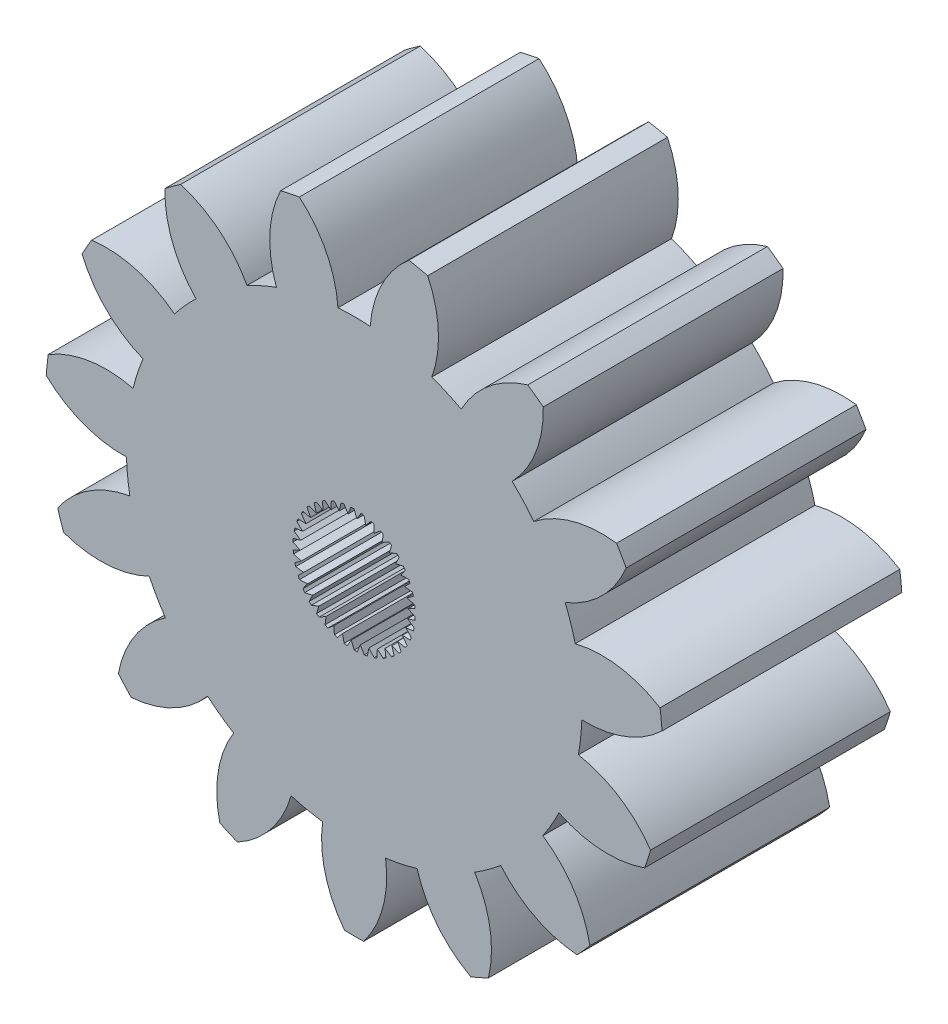
from build123d import *

# Parameters (mm, degrees)
SKETCH1_R           = 70.548036847
BOSS_EXTRUDE1_DEPTH = 10
SKETCH3_R           = 367.512428381
SKETCH3_R_2         = 2.25
CUT_EXTRUDE2_DEPTH  = 269.283414963
CUT_EXTRUDE4_DEPTH  = 10


with BuildPart() as part:
    # Sketch1 → Boss-Extrude1 (new body)
    with BuildSketch(Plane.XY):
        Circle(SKETCH1_R)
    extrude(amount=BOSS_EXTRUDE1_DEPTH)

    # Sketch3 → Cut-Extrude2 (cut, through all)
    # profile 1 of 2: a face of its own
    with BuildSketch(Plane(origin=(55.025604462, -141.718387499, 105.594585314), x_dir=(1, 0, 0), z_dir=(0, 0, 1))):
        with Locations((-43.46157653, 148.105383059)):
            Circle(SKETCH3_R)
        with BuildLine():
            ThreePointArc((-38.992966759, 156.489924055), (-37.83485513, 157.900828095), (-36.221197709, 158.75404699))
            ThreePointArc((-36.221197709, 158.75404699), (-35.892665836, 158.523094895), (-35.57149541, 158.282010639))
            ThreePointArc((-35.57149541, 158.282010639), (-35.884307233, 156.483672095), (-36.86828054, 154.946249158))
            ThreePointArc((-36.86828054, 154.946249158), (-36.400957543, 154.46279295), (-35.968998313, 153.947495063))
            ThreePointArc((-35.968998313, 153.947495063), (-34.337144322, 154.765373604), (-32.515959526, 154.888494247))
            ThreePointArc((-32.515959526, 154.888494247), (-32.309767406, 154.543883059), (-32.114421422, 154.193009851))
            ThreePointArc((-32.114421422, 154.193009851), (-33.131639425, 152.677377874), (-34.655870014, 151.673090132))
            ThreePointArc((-34.655870014, 151.673090132), (-34.425588569, 151.041353522), (-34.240564709, 150.394911831))
            ThreePointArc((-34.240564709, 150.394911831), (-32.417130736, 150.478346243), (-30.70331796, 149.850079957))
            ThreePointArc((-30.70331796, 149.850079957), (-30.655118083, 149.45139608), (-30.619373638, 149.051403085))
            ThreePointArc((-30.619373638, 149.051403085), (-32.165111587, 148.080544213), (-33.966046143, 147.783042142))
            ThreePointArc((-33.966046143, 147.783042142), (-34.012624002, 147.112258129), (-34.106527819, 146.446448275))
            ThreePointArc((-34.106527819, 146.446448275), (-32.406802163, 145.78101199), (-31.096695207, 144.509991723))
            ThreePointArc((-31.096695207, 144.509991723), (-31.21482177, 144.126171222), (-31.344859402, 143.746220863))
            ThreePointArc((-31.344859402, 143.746220863), (-33.151845163, 143.488005415), (-34.918085739, 143.948729824))
            ThreePointArc((-34.918085739, 143.948729824), (-35.233469169, 143.354883059), (-35.590063839, 142.784829614))
            ThreePointArc((-35.590063839, 142.784829614), (-34.307944508, 141.485582611), (-33.628072766, 139.791579314))
            ThreePointArc((-33.628072766, 139.791579314), (-33.892100612, 139.488988241), (-34.165435635, 139.194777386))
            ThreePointArc((-34.165435635, 139.194777386), (-35.921224953, 139.693853158), (-37.347372509, 140.833140613))
            ThreePointArc((-37.347372509, 140.833140613), (-37.877028848, 140.418912595), (-38.434655914, 140.04318298))
            ThreePointArc((-38.434655914, 140.04318298), (-37.791832987, 138.334776868), (-37.85975246, 136.510699101))
            ThreePointArc((-37.85975246, 136.510699101), (-38.224028777, 136.341658201), (-38.59339908, 136.18405858))
            ThreePointArc((-38.59339908, 136.18405858), (-39.994400032, 137.354130838), (-40.833860699, 138.974988187))
            ThreePointArc((-40.833860699, 138.974988187), (-41.486207556, 138.812002704), (-42.148448231, 138.695563981))
            ThreePointArc((-42.148448231, 138.695563981), (-42.256071633, 136.873397699), (-43.060038427, 135.234645079))
            ThreePointArc((-43.060038427, 135.234645079), (-43.46157653, 135.228383059), (-43.863114633, 135.234645079))
            ThreePointArc((-43.863114633, 135.234645079), (-44.667081427, 136.873397699), (-44.774704829, 138.695563981))
            ThreePointArc((-44.774704829, 138.695563981), (-45.436945504, 138.812002704), (-46.089292361, 138.974988187))
            ThreePointArc((-46.089292361, 138.974988187), (-46.928753028, 137.354130838), (-48.32975398, 136.18405858))
            ThreePointArc((-48.32975398, 136.18405858), (-48.699124283, 136.341658201), (-49.0634006, 136.510699101))
            ThreePointArc((-49.0634006, 136.510699101), (-49.131320073, 138.334776868), (-48.488497146, 140.04318298))
            ThreePointArc((-48.488497146, 140.04318298), (-49.046124212, 140.418912595), (-49.575780551, 140.833140613))
            ThreePointArc((-49.575780551, 140.833140613), (-51.001928107, 139.693853158), (-52.757717425, 139.194777386))
            ThreePointArc((-52.757717425, 139.194777386), (-53.031052448, 139.488988241), (-53.295080295, 139.791579314))
            ThreePointArc((-53.295080295, 139.791579314), (-52.615208552, 141.485582611), (-51.333089221, 142.784829614))
            ThreePointArc((-51.333089221, 142.784829614), (-51.689683891, 143.354883059), (-52.005067321, 143.948729824))
            ThreePointArc((-52.005067321, 143.948729824), (-53.771307897, 143.488005415), (-55.578293658, 143.746220863))
            ThreePointArc((-55.578293658, 143.746220863), (-55.70833129, 144.126171222), (-55.826457853, 144.509991723))
            ThreePointArc((-55.826457853, 144.509991723), (-54.516350897, 145.78101199), (-52.816625241, 146.446448275))
            ThreePointArc((-52.816625241, 146.446448275), (-52.910529058, 147.112258129), (-52.957106917, 147.783042142))
            ThreePointArc((-52.957106917, 147.783042142), (-54.758041473, 148.080544213), (-56.303779422, 149.051403085))
            ThreePointArc((-56.303779422, 149.051403085), (-56.268034977, 149.45139608), (-56.2198351, 149.850079957))
            ThreePointArc((-56.2198351, 149.850079957), (-54.506022324, 150.478346243), (-52.682588351, 150.394911831))
            ThreePointArc((-52.682588351, 150.394911831), (-52.497564491, 151.041353522), (-52.267283046, 151.673090132))
            ThreePointArc((-52.267283046, 151.673090132), (-53.791513635, 152.677377874), (-54.808731638, 154.193009851))
            ThreePointArc((-54.808731638, 154.193009851), (-54.613385655, 154.543883059), (-54.407193535, 154.888494247))
            ThreePointArc((-54.407193535, 154.888494247), (-52.586008738, 154.765373604), (-50.954154747, 153.947495063))
            ThreePointArc((-50.954154747, 153.947495063), (-50.522195517, 154.46279295), (-50.05487252, 154.946249158))
            ThreePointArc((-50.05487252, 154.946249158), (-51.038845827, 156.483672095), (-51.35165765, 158.282010639))
            ThreePointArc((-51.35165765, 158.282010639), (-51.030487224, 158.523094895), (-50.701955351, 158.75404699))
            ThreePointArc((-50.701955351, 158.75404699), (-49.08829793, 157.900828095), (-47.930186301, 156.489924055))
            ThreePointArc((-47.930186301, 156.489924055), (-47.325981376, 156.784978452), (-46.70242122, 157.036560288))
            ThreePointArc((-46.70242122, 157.036560288), (-46.97599932, 158.841284028), (-46.530316958, 160.611380068))
            ThreePointArc((-46.530316958, 160.611380068), (-46.138855373, 160.700989713), (-45.744789893, 160.778349))
            ThreePointArc((-45.744789893, 160.778349), (-44.617675875, 159.342561151), (-44.13355463, 157.582589738))
            ThreePointArc((-44.13355463, 157.582589738), (-43.46157653, 157.606383059), (-42.78959843, 157.582589738))
            ThreePointArc((-42.78959843, 157.582589738), (-42.305477185, 159.342561151), (-41.178363167, 160.778349))
            ThreePointArc((-41.178363167, 160.778349), (-40.784297687, 160.700989713), (-40.392836102, 160.611380068))
            ThreePointArc((-40.392836102, 160.611380068), (-39.94715374, 158.841284028), (-40.22073184, 157.036560288))
            ThreePointArc((-40.22073184, 157.036560288), (-39.597171684, 156.784978452), (-38.992966759, 156.489924055))
        make_face(mode=Mode.SUBTRACT)
    # profile 2 of 2: a face of its own
    with BuildSketch(Plane(origin=(55.025604462, -141.718387499, 105.594585314), x_dir=(1, 0, 0), z_dir=(0, 0, 1))):
        with Locations((-43.46157653, 148.105383059)):
            Circle(SKETCH3_R_2)
    extrude(amount=-CUT_EXTRUDE2_DEPTH, mode=Mode.SUBTRACT)

    # Sketch4 → Cut-Extrude4 (cut)
    with BuildSketch(Plane.XY.offset(10)):
        with BuildLine():
            Line((9.127956814, 5.633299661), (9.459541205, 5.590983238))
            Line((9.459541205, 5.590983238), (9.229545603, 5.360987636))
            ThreePointArc((9.229545603, 5.360987636), (9.256631549, 5.301444117), (9.285235916, 5.242614963))
            Line((9.285235916, 5.242614963), (9.619262983, 5.255452678))
            Line((9.619262983, 5.255452678), (9.430260253, 4.990737885))
            ThreePointArc((9.430260253, 4.990737885), (9.466777323, 4.936464661), (9.504674525, 4.883145984))
            Line((9.504674525, 4.883145984), (9.832032879, 4.950787658))
            Line((9.832032879, 4.950787658), (9.689178523, 4.658574403))
            ThreePointArc((9.689178523, 4.658574403), (9.734130627, 4.611051908), (9.780286925, 4.564698102))
            Line((9.780286926, 4.564698102), (10.092047085, 4.685298645))
            Line((10.092047085, 4.685298645), (9.999237798, 4.373557744))
            ThreePointArc((9.999237798, 4.373557744), (10.051398759, 4.334082267), (10.104555131, 4.295957744))
            Line((10.104555131, 4.295957744), (10.392213092, 4.466227489))
            Line((10.392213092, 4.466227489), (10.351980468, 4.143462421))
            ThreePointArc((10.351980468, 4.143462421), (10.409927472, 4.11311075), (10.46863395, 4.084255447))
            Line((10.468633951, 4.084255447), (10.724343152, 4.299549879))
            Line((10.724343152, 4.299549879), (10.737784633, 3.974564833))
            ThreePointArc((10.737784633, 3.974564833), (10.799937036, 3.954164882), (10.862592262, 3.935365897))
            Line((10.862592262, 3.935365897), (11.079377625, 4.189812345))
            Line((11.079377625, 4.189812345), (11.146126562, 3.871472066))
            ThreePointArc((11.146126562, 3.871472066), (11.210789009, 3.861580294), (11.27568391, 3.853350414))
            Line((11.27568391, 3.853350414), (11.447632094, 4.140008241))
            Line((11.447632094, 4.140008241), (11.565867751, 3.836996223))
            ThreePointArc((11.565867751, 3.836996223), (11.631276418, 3.837882451), (11.696640831, 3.840446165))
            Line((11.696640831, 3.840446165), (11.819061539, 4.151496094))
            Line((11.819061539, 4.151496094), (11.985558754, 3.872077715))
            ThreePointArc((11.985558754, 3.872077715), (12.049929464, 3.883717768), (12.113980419, 3.897005145))
            Line((12.113980419, 3.897005146), (12.183534331, 4.223962545))
            Line((12.183534331, 4.223962545), (12.393751495, 3.975759609))
            ThreePointArc((12.393751495, 3.975759609), (12.455328383, 3.997835978), (12.516318735, 4.021484573))
            Line((12.516318735, 4.021484574), (12.531108604, 4.355430899))
            Line((12.531108604, 4.355430899), (12.77931154, 4.145213735))
            ThreePointArc((12.779311541, 4.145213735), (12.836414949, 4.177124233), (12.892681042, 4.210488975))
            Line((12.892681042, 4.210488975), (12.852303437, 4.54231504))
            Line((12.852303437, 4.54231504), (13.131721817, 4.375817825))
            ThreePointArc((13.131721817, 4.375817825), (13.182794114, 4.416692018), (13.232801155, 4.458862802))
            Line((13.232801155, 4.458862802), (13.138357473, 4.779517257))
            Line((13.138357473, 4.779517257), (13.441369491, 4.6612816))
            ThreePointArc((13.441369491, 4.6612816), (13.485017557, 4.710004546), (13.527401484, 4.759831065))
            Line((13.527401484, 4.759831065), (13.381467903, 5.060567291))
            Line((13.381467903, 5.060567291), (13.699808181, 4.993818354))
            ThreePointArc((13.699808181, 4.993818354), (13.734841411, 5.049061018), (13.768446101, 5.105184133))
            Line((13.768446101, 5.105184133), (13.575003308, 5.377798832))
            Line((13.575003308, 5.377798832), (13.899988354, 5.364357351))
            ThreePointArc((13.899988354, 5.364357351), (13.925451133, 5.424612857), (13.949359937, 5.485501676))
            Line((13.949359937, 5.485501676), (13.713684547, 5.722558628))
            Line((13.713684547, 5.722558628), (14.036449615, 5.762791251))
            ThreePointArc((14.036449615, 5.762791251), (14.051647385, 5.826415987), (14.065208134, 5.890409621))
            Line((14.065208134, 5.890409621), (13.793728757, 6.085442531))
            Line((13.793728757, 6.085442531), (14.105469658, 6.178251819))
            ThreePointArc((14.105469658, 6.178251819), (14.109987863, 6.243510266), (14.112830655, 6.308863137))
            Line((14.112830655, 6.308863137), (13.812952541, 6.456552015))
            Line((13.812952541, 6.456552015), (14.105165796, 6.599406371))
            ThreePointArc((14.105165796, 6.599406371), (14.098881191, 6.66451845), (14.090928482, 6.729447901))
            Line((14.090928482, 6.729447901), (13.770831524, 6.825764181))
            Line((13.770831524, 6.825764181), (14.035546317, 7.01476691))
            ThreePointArc((14.035546317, 7.01476691), (14.01863033, 7.077956534), (14.000099049, 7.140691459))
            Line((14.000099049, 7.140691459), (13.668514658, 7.183007882))
            Line((13.668514658, 7.183007882), (13.89851026, 7.413003483))
            ThreePointArc((13.89851026, 7.413003483), (13.871424314, 7.472547002), (13.842819947, 7.531376156))
            Line((13.842819947, 7.531376157), (13.50879288, 7.518538442))
            Line((13.50879288, 7.518538442), (13.69779561, 7.783253235))
            ThreePointArc((13.69779561, 7.783253235), (13.66127854, 7.837526458), (13.623381338, 7.890845135))
            Line((13.623381339, 7.890845135), (13.296022984, 7.823203461))
            Line((13.296022984, 7.823203461), (13.43887734, 8.115416717))
            ThreePointArc((13.43887734, 8.115416717), (13.393925236, 8.162939212), (13.347768937, 8.209293017))
            Line((13.347768938, 8.209293017), (13.036008778, 8.088692474))
            Line((13.036008778, 8.088692474), (13.128818065, 8.400433375))
            ThreePointArc((13.128818065, 8.400433375), (13.076657104, 8.439908852), (13.023500732, 8.478033375))
            Line((13.023500732, 8.478033375), (12.735842771, 8.30776363))
            Line((12.735842771, 8.30776363), (12.776075395, 8.630528699))
            ThreePointArc((12.776075395, 8.630528698), (12.718128391, 8.660880369), (12.659421913, 8.689735672))
            Line((12.659421913, 8.689735672), (12.403712711, 8.474441241))
            Line((12.403712711, 8.474441241), (12.39027123, 8.799426286))
            ThreePointArc((12.39027123, 8.799426286), (12.328118827, 8.819826237), (12.265463601, 8.838625222))
            Line((12.265463601, 8.838625222), (12.048678238, 8.584178775))
            Line((12.048678238, 8.584178775), (11.981929301, 8.902519053))
            ThreePointArc((11.981929301, 8.902519053), (11.917266854, 8.912410825), (11.852371953, 8.920640705))
            Line((11.852371953, 8.920640705), (11.680423769, 8.633982878))
            Line((11.680423769, 8.633982878), (11.562188112, 8.936994896))
            ThreePointArc((11.562188112, 8.936994896), (11.496779445, 8.936108668), (11.431415032, 8.933544954))
            Line((11.431415032, 8.933544954), (11.308994324, 8.622495025))
            Line((11.308994324, 8.622495025), (11.142497109, 8.901913404))
            ThreePointArc((11.142497109, 8.901913404), (11.078126399, 8.890273351), (11.014075445, 8.876985973))
            Line((11.014075445, 8.876985974), (10.944521532, 8.550028574))
            Line((10.944521532, 8.550028574), (10.734304368, 8.79823151))
            ThreePointArc((10.734304368, 8.79823151), (10.67272748, 8.776155141), (10.611737128, 8.752506545))
            Line((10.611737128, 8.752506546), (10.596947259, 8.418560221))
            Line((10.596947259, 8.418560221), (10.348744323, 8.628777384))
            ThreePointArc((10.348744323, 8.628777384), (10.291640914, 8.596866886), (10.235374822, 8.563502144))
            Line((10.235374821, 8.563502144), (10.275752426, 8.23167608))
            Line((10.275752426, 8.23167608), (9.996334046, 8.398173295))
            ThreePointArc((9.996334046, 8.398173294), (9.945261749, 8.357299101), (9.895254709, 8.315128317))
            Line((9.895254709, 8.315128317), (9.98969839, 7.994473863))
            Line((9.98969839, 7.994473863), (9.686686372, 8.112709519))
            ThreePointArc((9.686686372, 8.112709519), (9.643038306, 8.063986573), (9.600654379, 8.014160054))
            Line((9.600654379, 8.014160054), (9.74658796, 7.713423828))
            Line((9.74658796, 7.713423828), (9.428247682, 7.780172765))
            ThreePointArc((9.428247682, 7.780172765), (9.393214452, 7.724930101), (9.359609762, 7.668806986))
            Line((9.359609762, 7.668806986), (9.553052555, 7.396192288))
            Line((9.553052555, 7.396192288), (9.228067509, 7.409633769))
            ThreePointArc((9.22806751, 7.409633769), (9.202604731, 7.349378262), (9.178695926, 7.288489444))
            Line((9.178695926, 7.288489444), (9.414371316, 7.051432492))
            Line((9.414371316, 7.051432492), (9.091606248, 7.011199868))
            ThreePointArc((9.091606248, 7.011199868), (9.076408479, 6.947575132), (9.062847729, 6.883581498))
            Line((9.062847729, 6.883581498), (9.334327106, 6.688548588))
            Line((9.334327106, 6.688548588), (9.022586205, 6.595739301))
            ThreePointArc((9.022586205, 6.595739301), (9.018068001, 6.530480853), (9.015225208, 6.465127982))
            Line((9.015225208, 6.465127982), (9.315103322, 6.317439104))
            Line((9.315103322, 6.317439104), (9.022890067, 6.174584748))
            ThreePointArc((9.022890067, 6.174584748), (9.029174673, 6.109472669), (9.037127381, 6.044543218))
            Line((9.037127381, 6.044543218), (9.357224339, 5.948226939))
            Line((9.357224339, 5.948226939), (9.092509546, 5.759224209))
            ThreePointArc((9.092509546, 5.759224209), (9.109425534, 5.696034586), (9.127956814, 5.633299661))
        make_face()
    extrude(amount=-CUT_EXTRUDE4_DEPTH, mode=Mode.SUBTRACT)


solid = part.part
